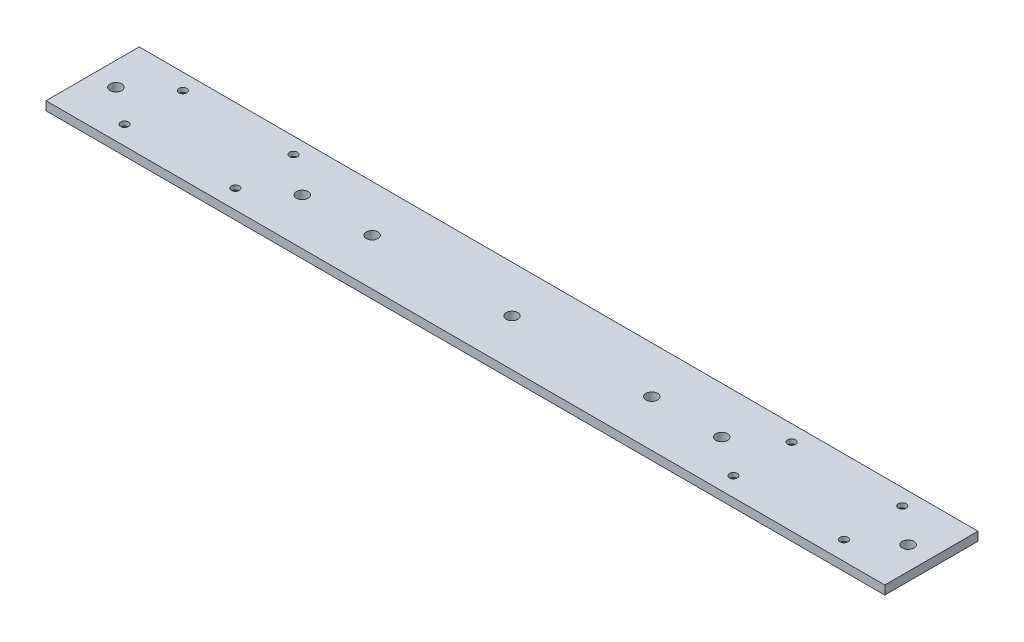
from build123d import *

# Parameters (mm, degrees)
SKETCH1_W                                     = 457.2
SKETCH1_H                                     = 50.8
BOSS_EXTRUDE1_DEPTH                           = 4.7625
SKETCH2_R                                     = 3.175
CUT_EXTRUDE1_DEPTH                            = 244.602
SKETCH3_R                                     = 3.175
CUT_EXTRUDE2_DEPTH                            = 244.602
SKETCH4_R                                     = 3.175
CUT_EXTRUDE4_DEPTH                            = 103.378
CSK_FOR_8_FLAT_HEAD_MACHINE_SCREW1_AT_2_COUNT = 2
CSK_FOR_8_FLAT_HEAD_MACHINE_SCREW1_AT_2_PITCH = 31.75
CSK_FOR_8_FLAT_HEAD_MACHINE_SCREW1_AT_3_COUNT = 2
CSK_FOR_8_FLAT_HEAD_MACHINE_SCREW1_AT_3_PITCH = 68.170141008
CSK_FOR_8_FLAT_HEAD_MACHINE_SCREW1_AT_4_COUNT = 2
CSK_FOR_8_FLAT_HEAD_MACHINE_SCREW1_AT_4_PITCH = 60.325
CSK_FOR_8_FLAT_HEAD_MACHINE_SCREW1_AT_5_COUNT = 2
CSK_FOR_8_FLAT_HEAD_MACHINE_SCREW1_AT_5_PITCH = 331.8
CSK_FOR_8_FLAT_HEAD_MACHINE_SCREW1_AT_6_COUNT = 2
CSK_FOR_8_FLAT_HEAD_MACHINE_SCREW1_AT_6_PITCH = 333.315619946
CSK_FOR_8_FLAT_HEAD_MACHINE_SCREW1_AT_7_COUNT = 2
CSK_FOR_8_FLAT_HEAD_MACHINE_SCREW1_AT_7_PITCH = 393.408284261
CSK_FOR_8_FLAT_HEAD_MACHINE_SCREW1_AT_8_COUNT = 2
CSK_FOR_8_FLAT_HEAD_MACHINE_SCREW1_AT_8_PITCH = 392.125


with BuildPart() as part:
    # Sketch1 → Boss-Extrude1 (new body)
    with BuildSketch(Plane(origin=(0, 0, 0), x_dir=(1, 0, 0), z_dir=(0, 1, 0))):
        with Locations((228.6, 25.4)):
            Rectangle(SKETCH1_W, SKETCH1_H)
    extrude(amount=BOSS_EXTRUDE1_DEPTH)

    # Sketch2 → Cut-Extrude1 (cut)
    with BuildSketch(Plane(origin=(0, 4.7625, 0), x_dir=(1, 0, 0), z_dir=(0, 1, 0))):
        with Locations((12.7, 25.4)):
            Circle(SKETCH2_R)
        with Locations((444.5, 25.4)):
            Circle(SKETCH2_R)
    extrude(amount=-CUT_EXTRUDE1_DEPTH, mode=Mode.SUBTRACT)

    # Sketch3 → Cut-Extrude2 (cut)
    with BuildSketch(Plane(origin=(0, 4.7625, 0), x_dir=(1, 0, 0), z_dir=(0, 1, 0))):
        with Locations((152.4, 25.4)):
            Circle(SKETCH3_R)
        with Locations((304.8, 25.4)):
            Circle(SKETCH3_R)
        with Locations((228.6, 25.4)):
            Circle(SKETCH3_R)
    extrude(amount=-CUT_EXTRUDE2_DEPTH, mode=Mode.SUBTRACT)

    # Sketch4 → Cut-Extrude4 (cut)
    with BuildSketch(Plane(origin=(0, 4.7625, 0), x_dir=(1, 0, 0), z_dir=(0, 1, 0))):
        with Locations((114.3, 25.4)):
            Circle(SKETCH4_R)
        with Locations((342.9, 25.4)):
            Circle(SKETCH4_R)
    extrude(amount=-CUT_EXTRUDE4_DEPTH, mode=Mode.SUBTRACT)

    # Sketch7 → CSK for #8 Flat Head Machine Screw1 (revolve, cut)
    with BuildSketch(Plane(origin=(424.6625, 0, -42.06875), x_dir=(0, 0, -1), z_dir=(1, 0, 0))):
        Polygon((0, 0), (0, 4.7625), (2.15265, 4.7625), (2.15265, 2.3740728), (4.2164, 0), align=None)
    csk_for_8_flat_head_machine_screw1 = revolve(axis=Axis((424.6625, -6.35, -42.06875), (0, 1, 0)), mode=Mode.SUBTRACT)

    # CSK for #8 Flat Head Machine Screw1 at 2: CSK for #8 Flat Head Machine Screw1 ×2
    with Locations(*[(0, 0, i * CSK_FOR_8_FLAT_HEAD_MACHINE_SCREW1_AT_2_PITCH) for i in range(1, CSK_FOR_8_FLAT_HEAD_MACHINE_SCREW1_AT_2_COUNT)]):
        add(csk_for_8_flat_head_machine_screw1, mode=Mode.SUBTRACT)

    # CSK for #8 Flat Head Machine Screw1 at 3: CSK for #8 Flat Head Machine Screw1 ×2
    with Locations(*[Vector(-0.8849182223819825, 0, 0.4657464328326222) * (i * CSK_FOR_8_FLAT_HEAD_MACHINE_SCREW1_AT_3_PITCH) for i in range(1, CSK_FOR_8_FLAT_HEAD_MACHINE_SCREW1_AT_3_COUNT)]):
        add(csk_for_8_flat_head_machine_screw1, mode=Mode.SUBTRACT)

    # CSK for #8 Flat Head Machine Screw1 at 4: CSK for #8 Flat Head Machine Screw1 ×2
    with Locations(*[(-i * CSK_FOR_8_FLAT_HEAD_MACHINE_SCREW1_AT_4_PITCH, 0, 0) for i in range(1, CSK_FOR_8_FLAT_HEAD_MACHINE_SCREW1_AT_4_COUNT)]):
        add(csk_for_8_flat_head_machine_screw1, mode=Mode.SUBTRACT)

    # CSK for #8 Flat Head Machine Screw1 at 5: CSK for #8 Flat Head Machine Screw1 ×2
    with Locations(*[(-i * CSK_FOR_8_FLAT_HEAD_MACHINE_SCREW1_AT_5_PITCH, 0, 0) for i in range(1, CSK_FOR_8_FLAT_HEAD_MACHINE_SCREW1_AT_5_COUNT)]):
        add(csk_for_8_flat_head_machine_screw1, mode=Mode.SUBTRACT)

    # CSK for #8 Flat Head Machine Screw1 at 6: CSK for #8 Flat Head Machine Screw1 ×2
    with Locations(*[Vector(-0.9954528985282298, 0, 0.09525506186941317) * (i * CSK_FOR_8_FLAT_HEAD_MACHINE_SCREW1_AT_6_PITCH) for i in range(1, CSK_FOR_8_FLAT_HEAD_MACHINE_SCREW1_AT_6_COUNT)]):
        add(csk_for_8_flat_head_machine_screw1, mode=Mode.SUBTRACT)

    # CSK for #8 Flat Head Machine Screw1 at 7: CSK for #8 Flat Head Machine Screw1 ×2
    with Locations(*[Vector(-0.9967380344743432, 0, 0.080704960394161) * (i * CSK_FOR_8_FLAT_HEAD_MACHINE_SCREW1_AT_7_PITCH) for i in range(1, CSK_FOR_8_FLAT_HEAD_MACHINE_SCREW1_AT_7_COUNT)]):
        add(csk_for_8_flat_head_machine_screw1, mode=Mode.SUBTRACT)

    # CSK for #8 Flat Head Machine Screw1 at 8: CSK for #8 Flat Head Machine Screw1 ×2
    with Locations(*[(-i * CSK_FOR_8_FLAT_HEAD_MACHINE_SCREW1_AT_8_PITCH, 0, 0) for i in range(1, CSK_FOR_8_FLAT_HEAD_MACHINE_SCREW1_AT_8_COUNT)]):
        add(csk_for_8_flat_head_machine_screw1, mode=Mode.SUBTRACT)


solid = part.part
